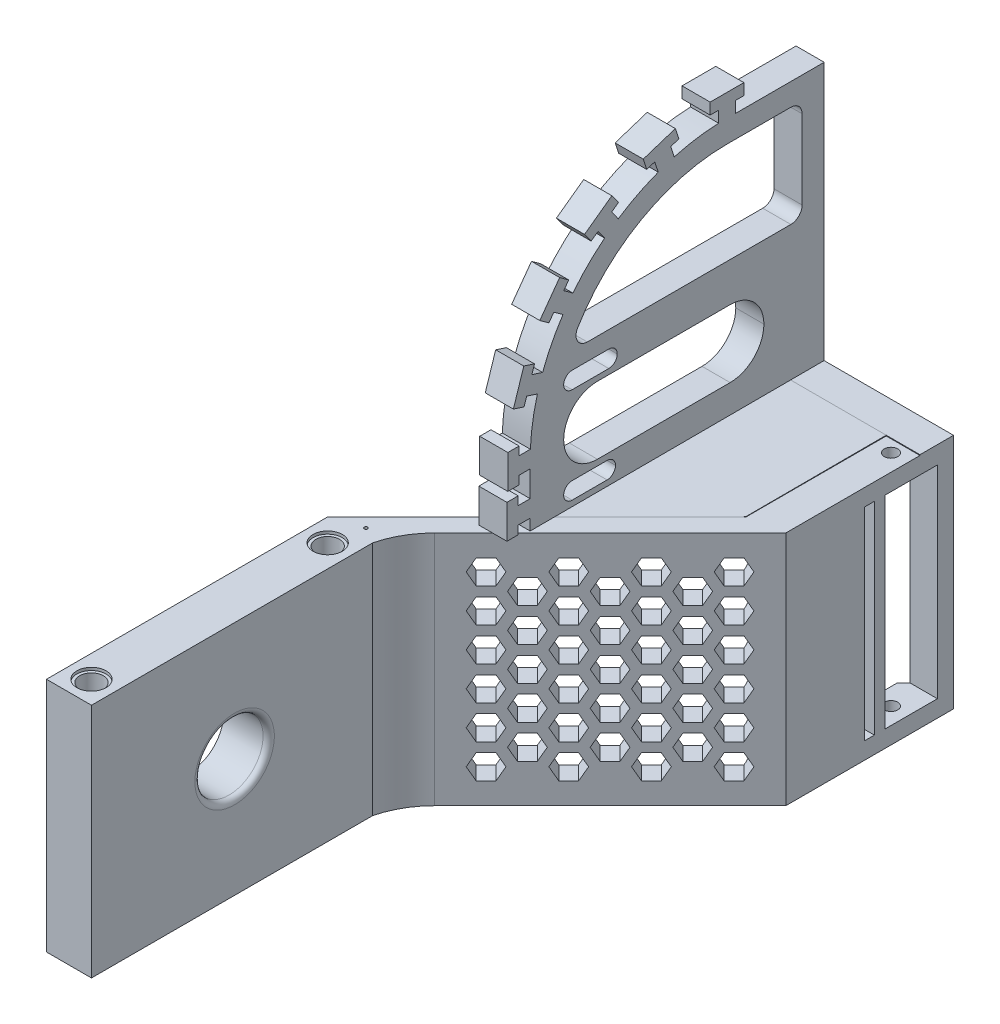
from build123d import *

# Parameters (mm, degrees)
SKETCH1_W                = 25
SKETCH1_H                = 50
SKETCH1_R                = 3.4
BOSS_EXTRUDE1_DEPTH      = 3
SKETCH2_W                = 50
SKETCH2_H                = 3
BOSS_EXTRUDE2_DEPTH      = 8
SKETCH3_W                = 8
SKETCH3_H                = 50
BOSS_EXTRUDE3_DEPTH      = 42
SKETCH4_R                = 2.65
CUT_EXTRUDE1_DEPTH       = 0.5
SKETCH5_R                = 6.062177826
CUT_EXTRUDE2_DEPTH       = 9
FILLET2_R                = 1
SKETCH6_R                = 12.6
BOSS_EXTRUDE4_DEPTH      = 2
FILLET4_R                = 1
SKETCH8_R                = 1.589780168
SKETCH8_R_2              = 1.777428262
CUT_EXTRUDE3_DEPTH       = 10
SKETCH9_W                = 49.021678163
SKETCH9_H                = 20.976854622
CUT_EXTRUDE4_DEPTH       = 68.79439129
SKETCH11_R               = 2.1
CUT_EXTRUDE5_DEPTH       = 59.480168703
SKETCH14_R               = 2.6
CUT_EXTRUDE6_DEPTH       = 0.5
BOSS_EXTRUDE5_DEPTH      = 42
FILLET5_R                = 15
BOSS_EXTRUDE6_DEPTH      = 42
BOSS_EXTRUDE7_DEPTH      = 2
BOSS_EXTRUDE7_DEPTH_BACK = 3
SKETCH17_W               = 55.081474993
SKETCH17_H               = 51.357900832
BOSS_EXTRUDE8_DEPTH      = 2
FILL_START               = -39.593416363
FILL_PATTERN1_DEPTH      = 4.479865946
SKETCH27_W               = 7.5
SKETCH27_H               = 36
CUT_EXTRUDE11_DEPTH      = 118.275157945
SKETCH28_R               = 1.2
CUT_EXTRUDE12_DEPTH      = 114.988906416
SKETCH29_W               = 6
SKETCH29_H               = 42
BOSS_EXTRUDE11_DEPTH     = 5.87
CHAMFER1_SIZE            = 4
SKETCH30_R               = 0.3
CUT_EXTRUDE13_DEPTH      = 120.102110599
SKETCH31_W               = 1.8
SKETCH31_H               = 36
CUT_EXTRUDE14_DEPTH      = 10
BOSS_EXTRUDE13_REACH     = 133.206
SKETCH33_W               = 28
SKETCH33_H               = 1.999994694
BOSS_EXTRUDE14_REACH     = 127.756
SKETCH34_W               = 5
SKETCH34_H               = 51.357900832
SKETCH35_W               = 43.798297797
SKETCH35_H               = 12
CUT_EXTRUDE15_DEPTH      = 5
SKETCH36_W               = 5
SKETCH36_H               = 12
BOSS_EXTRUDE15_DEPTH     = 8.2
FILLET6_R                = 6
SKETCH37_W               = 9.524150039
SKETCH37_H               = 3
SKETCH37_W_2             = 9.213307868
CUT_EXTRUDE16_DEPTH      = 7.4
FILLET7_R                = 1.5
SKETCH38_W               = 3
SKETCH38_H               = 36
CUT_EXTRUDE17_DEPTH      = 7.4
CUT_EXTRUDE19_DEPTH      = 10
CUT_EXTRUDE20_DEPTH      = 10
FILLET8_R                = 2


# Read off the part's stored shape, not the designer's step: Fill Pattern1
# Some blends are built 0.0001 mm under size
with BuildPart() as part:
    # Sketch1 → Boss-Extrude1 (new body)
    with BuildSketch(Plane(origin=(0, 0, 0), x_dir=(1, 0, 0), z_dir=(0, 1, 0))):
        with Locations((2.276951673, 11.384758364)):
            Rectangle(SKETCH1_W, SKETCH1_H)
        with Locations(Location((1.276951673, 11.384758364, 0), (0, 0, 270))):
            Circle(SKETCH1_R, mode=Mode.SUBTRACT)
    extrude(amount=BOSS_EXTRUDE1_DEPTH)

    # Sketch2 → Boss-Extrude2 (add)
    with BuildSketch(Plane.ZY.offset(10.223048327)):
        with Locations((-11.384758364, 1.5)):
            Rectangle(SKETCH2_W, SKETCH2_H)
    extrude(amount=BOSS_EXTRUDE2_DEPTH)

    # Sketch3 → Boss-Extrude3 (add)
    with BuildSketch(Plane.XZ):
        with Locations((-14.223048327, -11.384758364)):
            Rectangle(SKETCH3_W, SKETCH3_H)
    extrude(amount=BOSS_EXTRUDE3_DEPTH)

    # Sketch4 → Cut-Extrude1 (cut)
    with BuildSketch(Plane(origin=(0, 3, 0), x_dir=(1, 0, 0), z_dir=(0, 1, 0))):
        with Locations(Location((-14.223048327, 32.384758364, 0), (0, 0, 270))):
            Circle(SKETCH4_R)
        with Locations(Location((-14.223048327, -9.615241636, 0), (0, 0, 270))):
            Circle(SKETCH4_R)
    cut_extrude1 = extrude(amount=-CUT_EXTRUDE1_DEPTH, mode=Mode.SUBTRACT)

    # Mirror1: Cut-Extrude1 across plane
    add(cut_extrude1.mirror(Plane.ZX.offset(-19.5)), mode=Mode.SUBTRACT)

    # Sketch5 → Cut-Extrude2 (cut)
    with BuildSketch(Plane.ZY.offset(18.223048327)):
        with Locations((-11.836279124, -21)):
            Circle(SKETCH5_R)
    extrude(amount=-CUT_EXTRUDE2_DEPTH, mode=Mode.SUBTRACT)

    # Fillet2
    fillet2_edges = [part.edges().sort_by_distance(p)[0] for p in [
        (-10.223048327, -21, -17.89845695),
    ]]
    fillet(fillet2_edges, radius=FILLET2_R)

    # Mirror2: Cut-Extrude1 across plane
    add(cut_extrude1.mirror(Plane.ZY.offset(1.723048327)), mode=Mode.SUBTRACT)

    # Sketch6 → Boss-Extrude4 (add)
    with BuildSketch(Plane(origin=(0, 3, 0), x_dir=(1, 0, 0), z_dir=(0, 1, 0))):
        with BuildLine():
            Line((14.776951673, 5.825082115), (14.776951673, 16.944434614))
            ThreePointArc((14.776951673, 16.944434614), (-13.323048327, 11.384758364), (14.776951673, 5.825082115))
        make_face()
        with Locations(Location((1.276951673, 11.384758364, 0), (0, 0, 270))):
            Circle(SKETCH6_R, mode=Mode.SUBTRACT)
    extrude(amount=BOSS_EXTRUDE4_DEPTH)

    # Fillet4
    # the kernel refuses this fillet: 1 mm, written as the material it takes off along each edge
    with BuildSketch(Plane(origin=(14.776951673, 5, -3.325082115), x_dir=(0, -1, 0), z_dir=(0, 0, -1))) as fillet4_piece_1:
        with BuildLine():
            CenterArc((FILLET4_R, FILLET4_R), FILLET4_R, 180, 90)
            Line((0, FILLET4_R), (0, 0))
            Line((0, 0), (FILLET4_R, 0))
        make_face()
    extrude(amount=16.119352499, mode=Mode.SUBTRACT)

    # Sketch8 → Cut-Extrude3 (cut)
    with BuildSketch(Plane(origin=(0, 3, 0), x_dir=(1, 0, 0), z_dir=(0, 1, 0))):
        with Locations(Location((1.276951673, 19.884758364, 0), (0, 0, 270))):
            Circle(SKETCH8_R)
        with Locations(Location((1.276951673, 2.884758364, 0), (0, 0, 270))):
            Circle(SKETCH8_R_2)
    extrude(amount=-CUT_EXTRUDE3_DEPTH, mode=Mode.SUBTRACT)

    # Sketch9 → Cut-Extrude4 (cut, through all)
    with BuildSketch(Plane.XY.offset(13.615241636)):
        with Locations((-9.733887409, 10.488427311)):
            Rectangle(SKETCH9_W, SKETCH9_H)
    extrude(amount=-CUT_EXTRUDE4_DEPTH, mode=Mode.SUBTRACT)

    # Sketch11 → Cut-Extrude5 (cut, through all)
    with BuildSketch(Plane(origin=(0, 0, 0), x_dir=(1, 0, 0), z_dir=(0, 1, 0))):
        with Locations(Location((-14.223048327, 32.384758364, 0), (0, 0, 270))):
            Circle(SKETCH11_R)
    cut_extrude5 = extrude(amount=-CUT_EXTRUDE5_DEPTH, mode=Mode.SUBTRACT)

    # Mirror3: Cut-Extrude5 across plane
    add(cut_extrude5.mirror(Plane.XY.offset(-11.384758364)), mode=Mode.SUBTRACT)

    # Sketch14 → Cut-Extrude6 (cut)
    with BuildSketch(Plane(origin=(0, 0, 0), x_dir=(1, 0, 0), z_dir=(0, 1, 0))):
        with Locations(Location((-14.223048327, -9.615241636, 0), (0, 0, 270))):
            Circle(SKETCH14_R)
    cut_extrude6 = extrude(amount=-CUT_EXTRUDE6_DEPTH, mode=Mode.SUBTRACT)

    # Mirror4: Cut-Extrude6 across plane
    add(cut_extrude6.mirror(Plane.XY.offset(-11.384758364)), mode=Mode.SUBTRACT)

    # Sketch15 → Boss-Extrude5 (add)
    with BuildSketch(Plane(origin=(0, 0, 0), x_dir=(1, 0, 0), z_dir=(0, 1, 0))):
        Polygon((-18.223048327, 36.384758364), (24.976951673, 79.584758364), (24.976951673, 74.635010896), (-13.273300859, 36.384758364), align=None)
    extrude(amount=-BOSS_EXTRUDE5_DEPTH)

    # Fillet5
    # the kernel refuses this fillet: 15 mm, written as the material it adds along each edge
    with BuildSketch(Plane(origin=(-13.273300859, 0, -36.384758364), x_dir=(1, 0, 0), z_dir=(0, -1, 0))) as fillet5_piece_1:
        with BuildLine():
            CenterArc((17.611399837, 3.601803599), FILLET5_R, 193.893637127, 31.106362873)
            Line((7.004798119, -7.004798119), (0, 0))
            Line((0, 0), (3.050252532, 0))
        make_face()
    extrude(amount=42)

    # Sketch16 → Boss-Extrude6 (add)
    with BuildSketch(Plane(origin=(0, 0, 0), x_dir=(1, 0, 0), z_dir=(0, 1, 0))):
        Polygon((18.976951673, 73.584758364), (18.976951673, 98.584758364), (24.976951673, 98.584758364), (24.976951673, 79.584758364), align=None)
    extrude(amount=-BOSS_EXTRUDE6_DEPTH)



with BuildPart() as body_2:
    # Sketch17 → Boss-Extrude7 (new, two sides: drawn at the far end of the back side and taken through both)
    with BuildSketch(Plane(origin=(-0.023048327, -88.270826713, 236.630045038), x_dir=(0, 0.002303401717977271, -0.999997347166744), z_dir=(1, 0, 0)).offset(-BOSS_EXTRUDE7_DEPTH_BACK)):
        with Locations((307.762919346, 113.30454533)):
            Rectangle(SKETCH17_W, SKETCH17_H)
    extrude(amount=BOSS_EXTRUDE7_DEPTH + BOSS_EXTRUDE7_DEPTH_BACK)


with BuildPart() as part_1:
    add(part.part)

    add(body_2.part)  # Boss-Extrude8 merges body 2
    # Sketch18 → Boss-Extrude8 (add)
    with BuildSketch(Plane(origin=(0, -0.099943314, -0.00023021), x_dir=(1, 0, 0), z_dir=(0, -0.9999973471667442, -0.0023034017179773937))):
        Polygon((-3.023048327, -98.470916371), (-3.023048327, -51.487878646), (18.976951673, -73.487820284), (18.976951673, -98.487753963), (-3.023048327, -98.487753963), align=None)
    extrude(amount=BOSS_EXTRUDE8_DEPTH)

    # Fill Pattern1 outline → Fill Pattern1 (cut)
    with BuildSketch(Plane(origin=(0, 0, 0), x_dir=(0.7071067811865457, 0, -0.7071067811865495), z_dir=(0.7071067811865493, 0, 0.7071067811865458)).offset(FILL_START)):
        Polygon((30.253964255, -6), (31.503964255, -8.165063509), (34.003964255, -8.165063509), (35.253964255, -6), (34.003964255, -3.834936491), (31.503964255, -3.834936491), align=None)
        Polygon((45.842421523, -33), (47.092421523, -35.165063509), (49.592421523, -35.165063509), (50.842421523, -33), (49.592421523, -30.834936491), (47.092421523, -30.834936491), align=None)
        Polygon((40.6462691, -24), (41.8962691, -26.165063509), (44.3962691, -26.165063509), (45.6462691, -24), (44.3962691, -21.834936491), (41.8962691, -21.834936491), align=None)
        Polygon((35.450116678, -15), (36.700116678, -17.165063509), (39.200116678, -17.165063509), (40.450116678, -15), (39.200116678, -12.834936491), (36.700116678, -12.834936491), align=None)
        Polygon((52.288573946, -8.165063509), (54.788573946, -8.165063509), (56.038573946, -6), (54.788573946, -3.834936491), (52.288573946, -3.834936491), (51.038573946, -6), align=None)
        Polygon((41.8962691, -8.165063509), (44.3962691, -8.165063509), (45.6462691, -6), (44.3962691, -3.834936491), (41.8962691, -3.834936491), (40.6462691, -6), align=None)
        Polygon((62.680878791, -8.165063509), (65.180878791, -8.165063509), (66.430878791, -6), (65.180878791, -3.834936491), (62.680878791, -3.834936491), (61.430878791, -6), align=None)
        Polygon((30.253964255, -24), (31.503964255, -26.165063509), (34.003964255, -26.165063509), (35.253964255, -24), (34.003964255, -21.834936491), (31.503964255, -21.834936491), align=None)
        Polygon((35.450116678, -33), (36.700116678, -35.165063509), (39.200116678, -35.165063509), (40.450116678, -33), (39.200116678, -30.834936491), (36.700116678, -30.834936491), align=None)
        Polygon((62.680878791, -26.165063509), (65.180878791, -26.165063509), (66.430878791, -24), (65.180878791, -21.834936491), (62.680878791, -21.834936491), (61.430878791, -24), align=None)
        Polygon((52.288573946, -26.165063509), (54.788573946, -26.165063509), (56.038573946, -24), (54.788573946, -21.834936491), (52.288573946, -21.834936491), (51.038573946, -24), align=None)
        Polygon((57.484726369, -35.165063509), (59.984726369, -35.165063509), (61.234726369, -33), (59.984726369, -30.834936491), (57.484726369, -30.834936491), (56.234726369, -33), align=None)
        Polygon((49.592421523, -17.165063509), (50.842421523, -15), (49.592421523, -12.834936491), (47.092421523, -12.834936491), (45.842421523, -15), (47.092421523, -17.165063509), align=None)
        Polygon((35.450116678, -27), (36.700116678, -29.165063509), (39.200116678, -29.165063509), (40.450116678, -27), (39.200116678, -24.834936491), (36.700116678, -24.834936491), align=None)
        Polygon((30.253964255, -18), (31.503964255, -20.165063509), (34.003964255, -20.165063509), (35.253964255, -18), (34.003964255, -15.834936491), (31.503964255, -15.834936491), align=None)
        Polygon((40.6462691, -36), (41.8962691, -38.165063509), (44.3962691, -38.165063509), (45.6462691, -36), (44.3962691, -33.834936491), (41.8962691, -33.834936491), align=None)
        Polygon((57.484726369, -29.165063509), (59.984726369, -29.165063509), (61.234726369, -27), (59.984726369, -24.834936491), (57.484726369, -24.834936491), (56.234726369, -27), align=None)
        Polygon((47.092421523, -29.165063509), (49.592421523, -29.165063509), (50.842421523, -27), (49.592421523, -24.834936491), (47.092421523, -24.834936491), (45.842421523, -27), align=None)
        Polygon((34.003964255, -38.165063509), (35.253964255, -36), (34.003964255, -33.834936491), (31.503964255, -33.834936491), (30.253964255, -36), (31.503964255, -38.165063509), align=None)
        Polygon((49.592421523, -11.165063509), (50.842421523, -9), (49.592421523, -6.834936491), (47.092421523, -6.834936491), (45.842421523, -9), (47.092421523, -11.165063509), align=None)
        Polygon((44.3962691, -20.165063509), (45.6462691, -18), (44.3962691, -15.834936491), (41.8962691, -15.834936491), (40.6462691, -18), (41.8962691, -20.165063509), align=None)
        Polygon((35.450116678, -21), (36.700116678, -23.165063509), (39.200116678, -23.165063509), (40.450116678, -21), (39.200116678, -18.834936491), (36.700116678, -18.834936491), align=None)
        Polygon((30.253964255, -12), (31.503964255, -14.165063509), (34.003964255, -14.165063509), (35.253964255, -12), (34.003964255, -9.834936491), (31.503964255, -9.834936491), align=None)
        Polygon((40.6462691, -30), (41.8962691, -32.165063509), (44.3962691, -32.165063509), (45.6462691, -30), (44.3962691, -27.834936491), (41.8962691, -27.834936491), align=None)
        Polygon((57.484726369, -23.165063509), (59.984726369, -23.165063509), (61.234726369, -21), (59.984726369, -18.834936491), (57.484726369, -18.834936491), (56.234726369, -21), align=None)
        Polygon((47.092421523, -23.165063509), (49.592421523, -23.165063509), (50.842421523, -21), (49.592421523, -18.834936491), (47.092421523, -18.834936491), (45.842421523, -21), align=None)
        Polygon((34.003964255, -32.165063509), (35.253964255, -30), (34.003964255, -27.834936491), (31.503964255, -27.834936491), (30.253964255, -30), (31.503964255, -32.165063509), align=None)
        Polygon((44.3962691, -14.165063509), (45.6462691, -12), (44.3962691, -9.834936491), (41.8962691, -9.834936491), (40.6462691, -12), (41.8962691, -14.165063509), align=None)
        Polygon((62.680878791, -32.165063509), (65.180878791, -32.165063509), (66.430878791, -30), (65.180878791, -27.834936491), (62.680878791, -27.834936491), (61.430878791, -30), align=None)
        Polygon((52.288573946, -32.165063509), (54.788573946, -32.165063509), (56.038573946, -30), (54.788573946, -27.834936491), (52.288573946, -27.834936491), (51.038573946, -30), align=None)
        Polygon((62.680878791, -38.165063509), (65.180878791, -38.165063509), (66.430878791, -36), (65.180878791, -33.834936491), (62.680878791, -33.834936491), (61.430878791, -36), align=None)
        Polygon((52.288573946, -38.165063509), (54.788573946, -38.165063509), (56.038573946, -36), (54.788573946, -33.834936491), (52.288573946, -33.834936491), (51.038573946, -36), align=None)
        Polygon((56.234726369, -15), (57.484726369, -17.165063509), (59.984726369, -17.165063509), (61.234726369, -15), (59.984726369, -12.834936491), (57.484726369, -12.834936491), align=None)
        Polygon((56.234726369, -9), (57.484726369, -11.165063509), (59.984726369, -11.165063509), (61.234726369, -9), (59.984726369, -6.834936491), (57.484726369, -6.834936491), align=None)
        Polygon((61.430878791, -18), (62.680878791, -20.165063509), (65.180878791, -20.165063509), (66.430878791, -18), (65.180878791, -15.834936491), (62.680878791, -15.834936491), align=None)
        Polygon((36.700116678, -11.165063509), (39.200116678, -11.165063509), (40.450116678, -9), (39.200116678, -6.834936491), (36.700116678, -6.834936491), (35.450116678, -9), align=None)
        Polygon((54.788573946, -20.165063509), (56.038573946, -18), (54.788573946, -15.834936491), (52.288573946, -15.834936491), (51.038573946, -18), (52.288573946, -20.165063509), align=None)
        Polygon((62.680878791, -14.165063509), (65.180878791, -14.165063509), (66.430878791, -12), (65.180878791, -9.834936491), (62.680878791, -9.834936491), (61.430878791, -12), align=None)
        Polygon((52.288573946, -14.165063509), (54.788573946, -14.165063509), (56.038573946, -12), (54.788573946, -9.834936491), (52.288573946, -9.834936491), (51.038573946, -12), align=None)
    extrude(amount=FILL_PATTERN1_DEPTH, mode=Mode.SUBTRACT)

    # Sketch27 → Cut-Extrude11 (cut, through all)
    with BuildSketch(Plane.ZY.offset(-18.976951673)):
        with Locations((-97.834758364, -21)):
            Rectangle(SKETCH27_W, SKETCH27_H)
    extrude(amount=-CUT_EXTRUDE11_DEPTH, mode=Mode.SUBTRACT)

    # Sketch28 → Cut-Extrude12 (cut, through all)
    with BuildSketch(Plane(origin=(0, 0, 0), x_dir=(1, 0, 0), z_dir=(0, 1, 0))):
        with Locations(Location((21.976951673, 96.334758364, 0), (0, 0, 270))):
            Circle(SKETCH28_R)
    extrude(amount=-CUT_EXTRUDE12_DEPTH, mode=Mode.SUBTRACT)

    # Sketch29 → Boss-Extrude11 (add)
    with BuildSketch(Plane(origin=(0, 0, -98.584758364), x_dir=(-1, 0, 0), z_dir=(0, 0, -1))):
        with Locations((-21.976951673, -21)):
            Rectangle(SKETCH29_W, SKETCH29_H)
    extrude(amount=BOSS_EXTRUDE11_DEPTH)

    # Chamfer1
    chamfer1_edges = [part_1.edges().sort_by_distance(p)[0] for p in [
        (18.976951673, -21, -104.454758364),
    ]]
    chamfer(chamfer1_edges, length=CHAMFER1_SIZE)

    # Sketch30 → Cut-Extrude13 (cut, through all)
    with BuildSketch(Plane(origin=(0, 0, 0), x_dir=(1, 0, 0), z_dir=(0, 1, 0))):
        with Locations(Location((-13.114758504, 38.068023801, 0), (0, 0, 270))):
            Circle(SKETCH30_R)
    extrude(amount=-CUT_EXTRUDE13_DEPTH, mode=Mode.SUBTRACT)

    # Sketch31 → Cut-Extrude14 (cut)
    with BuildSketch(Plane(origin=(24.976951673, 0, 0), x_dir=(0, 0, -1), z_dir=(1, 0, 0))):
        with Locations((93.184758364, -21)):
            Rectangle(SKETCH31_W, SKETCH31_H)
        with Locations((89.484758364, -21)):
            Rectangle(SKETCH31_W, SKETCH31_H)
    extrude(amount=-CUT_EXTRUDE14_DEPTH, mode=Mode.SUBTRACT)

    # Boss-Extrude13: up to this plane
    boss_extrude13_end = Plane(origin=(18.976951673, -1.873081146, -98.492329705), z_dir=(0, -0.0023034017179773933, 0.999997347166744))
    # Sketch33 → Boss-Extrude13 (add, up to the surface)
    with BuildSketch(Plane(origin=(0, 0, -104.454758364), x_dir=(-1, 0, 0), z_dir=(0, 0, -1)), mode=Mode.PRIVATE) as boss_extrude13_sk1:
        with Locations((-10.976951673, -0.873083799)):
            Rectangle(SKETCH33_W, SKETCH33_H)
    boss_extrude13_tool1 = split(extrude(boss_extrude13_sk1.sketch, amount=-BOSS_EXTRUDE13_REACH, mode=Mode.PRIVATE), bisect_by=boss_extrude13_end, keep=Keep.BOTH, mode=Mode.PRIVATE)
    add(boss_extrude13_tool1.solids().sort_by_distance((10.976952, -0.873084, -104.454758))[0])

    # Boss-Extrude14: up to this plane
    boss_extrude14_end = Plane(origin=(0, 0, -104.454758364), z_dir=(0, 0, -1))
    # Sketch34 → Boss-Extrude14 (add, up to the surface)
    with BuildSketch(Plane(origin=(0, 0.226818078, -98.470655144), x_dir=(-1, 0, 0), z_dir=(0, 0.0023034017179766083, -0.9999973471667442)), mode=Mode.PRIVATE) as boss_extrude14_sk1:
        with Locations((0.523048327, 25.579006837)):
            Rectangle(SKETCH34_W, SKETCH34_H)
    boss_extrude14_tool1 = split(extrude(boss_extrude14_sk1.sketch, amount=BOSS_EXTRUDE14_REACH, mode=Mode.PRIVATE), bisect_by=boss_extrude14_end, keep=Keep.BOTH, mode=Mode.PRIVATE)
    add(boss_extrude14_tool1.solids().sort_by_distance((-0.523048, 25.805757, -98.411736))[0])

    # Sketch35 → Cut-Extrude15 (cut)
    with BuildSketch(Plane(origin=(1.976951673, 0, 0), x_dir=(0, 0, -1), z_dir=(1, 0, 0))):
        with Locations((80.040234019, 11.100907392)):
            Rectangle(SKETCH35_W, SKETCH35_H)
    extrude(amount=-CUT_EXTRUDE15_DEPTH, mode=Mode.SUBTRACT)

    # Sketch36 → Boss-Extrude15 (add)
    with BuildSketch(Plane.XY.offset(-101.939382917)):
        with Locations((-0.523048327, 11.100907392)):
            Rectangle(SKETCH36_W, SKETCH36_H)
    extrude(amount=BOSS_EXTRUDE15_DEPTH)

    # Fillet6
    fillet6_edges = [part_1.edges().sort_by_distance(p)[0] for p in [
        (-0.523048327, 17.100907392, -58.14108512),
        (-0.523048327, 5.100907392, -58.14108512),
        (-0.523048327, 5.100907392, -93.739382917),
        (-0.523048327, 17.100907392, -93.739382917),
    ]]
    fillet(fillet6_edges, radius=FILLET6_R - 0.0001)  # a hair under: the kernel refuses the full size

    # Sketch37 → Cut-Extrude16 (cut)
    with BuildSketch(Plane(origin=(1.976951673, 0, 0), x_dir=(0, 0, -1), z_dir=(1, 0, 0))):
        with Locations((62.90316014, 19.552513407)):
            Rectangle(SKETCH37_W, SKETCH37_H)
        with Locations((62.747739054, 2.552558505)):
            Rectangle(SKETCH37_W_2, SKETCH37_H)
    extrude(amount=-CUT_EXTRUDE16_DEPTH, mode=Mode.SUBTRACT)

    # Fillet7
    fillet7_edges = [part_1.edges().sort_by_distance(p)[0] for p in [
        (-0.523048327, 18.052513407, -58.14108512),
        (-0.523048327, 1.052558505, -58.14108512),
        (-0.523048327, 4.052558505, -58.14108512),
        (-0.523048327, 21.052513407, -58.14108512),
        (-0.523048327, 18.052513407, -67.665235159),
        (-0.523048327, 4.052558505, -67.354392988),
        (-0.523048327, 21.052513407, -67.665235159),
        (-0.523048327, 1.052558505, -67.354392988),
    ]]
    fillet(fillet7_edges, radius=FILLET7_R - 0.0001)  # a hair under: the kernel refuses the full size

    # Sketch38 → Cut-Extrude17 (cut)
    with BuildSketch(Plane(origin=(24.976951673, 0, 0), x_dir=(0, 0, -1), z_dir=(1, 0, 0))):
        with Locations((100.084758364, -21)):
            Rectangle(SKETCH38_W, SKETCH38_H)
    extrude(amount=-CUT_EXTRUDE17_DEPTH, mode=Mode.SUBTRACT)

    # Sketch41 → Cut-Extrude19 (cut)
    with BuildSketch(Plane(origin=(1.976951673, 0, 0), x_dir=(0, 0, -1), z_dir=(1, 0, 0))):
        with BuildLine():
            Line((50.054130992, 5.00608367), (52.184758364, 5.00608367))
            Line((52.184758364, 5.00608367), (52.184758364, 9.600907392))
            Line((52.184758364, 9.600907392), (50.216915995, 9.600907392))
            Line((50.216915995, 9.600907392), (50.216915995, 8.100907392))
            Line((50.216915995, 8.100907392), (48.216915995, 8.100907392))
            Line((48.216915995, 8.100907392), (48.216915995, 14.100907392))
            Line((48.216915995, 14.100907392), (50.216915995, 14.100907392))
            Line((50.216915995, 14.100907392), (50.216915995, 12.600907392))
            Line((50.216915995, 12.600907392), (52.216915995, 12.600907392))
            ThreePointArc((52.216915995, 12.600907392), (52.615666443, 16.576113669), (53.464838526, 20.479980167))
            Line((53.464838526, 20.479980167), (51.562725494, 21.098014155))
            Line((51.562725494, 21.098014155), (51.099200002, 19.671429381))
            Line((51.099200002, 19.671429381), (49.197086969, 20.28946337))
            Line((49.197086969, 20.28946337), (51.051188936, 25.995802467))
            Line((51.051188936, 25.995802467), (52.953301968, 25.377768479))
            Line((52.953301968, 25.377768479), (52.489776477, 23.951183704))
            Line((52.489776477, 23.951183704), (54.391889509, 23.333149715))
            ThreePointArc((54.391889509, 23.333149715), (55.999530018, 26.990574883), (58.013501752, 30.44096395))
            Line((58.013501752, 30.44096395), (56.395467763, 31.616534455))
            Line((56.395467763, 31.616534455), (55.513789885, 30.403008963))
            Line((55.513789885, 30.403008963), (53.895755896, 31.578579468))
            Line((53.895755896, 31.578579468), (57.42246741, 36.432681434))
            Line((57.42246741, 36.432681434), (59.040501399, 35.257110929))
            Line((59.040501399, 35.257110929), (58.15882352, 34.043585438))
            Line((58.15882352, 34.043585438), (59.776857509, 32.868014933))
            ThreePointArc((59.776857509, 32.868014933), (62.436021023, 35.849644734), (65.417650823, 38.508808247))
            Line((65.417650823, 38.508808247), (64.242080319, 40.126842236))
            Line((64.242080319, 40.126842236), (63.028554827, 39.245164358))
            Line((63.028554827, 39.245164358), (61.852984323, 40.863198347))
            Line((61.852984323, 40.863198347), (66.707086289, 44.38990986))
            Line((66.707086289, 44.38990986), (67.882656793, 42.771875872))
            Line((67.882656793, 42.771875872), (66.669131302, 41.890197993))
            Line((66.669131302, 41.890197993), (67.844701806, 40.272164004))
            ThreePointArc((67.844701806, 40.272164004), (71.295090873, 42.286135739), (74.952516041, 43.893776247))
            Line((74.952516041, 43.893776247), (74.334482052, 45.79588928))
            Line((74.334482052, 45.79588928), (72.907897278, 45.332363788))
            Line((72.907897278, 45.332363788), (72.289863289, 47.234476821))
            Line((72.289863289, 47.234476821), (77.996202387, 49.088578787))
            Line((77.996202387, 49.088578787), (78.614236376, 47.186465754))
            Line((78.614236376, 47.186465754), (77.187651601, 46.722940263))
            Line((77.187651601, 46.722940263), (77.80568559, 44.82082723))
            ThreePointArc((77.80568559, 44.82082723), (81.709552088, 45.669999313), (85.684758364, 46.068749762))
            Line((85.684758364, 46.068749762), (85.684758364, 48.068749762))
            Line((85.684758364, 48.068749762), (84.184758364, 48.068749762))
            Line((84.184758364, 48.068749762), (84.184758364, 50.068749762))
            Line((84.184758364, 50.068749762), (90.184758364, 50.068749762))
            Line((90.184758364, 50.068749762), (90.184758364, 48.068749762))
            Line((90.184758364, 48.068749762), (88.684758364, 48.068749762))
            Line((88.684758364, 48.068749762), (88.684758364, 46.068749762))
            Line((88.684758364, 46.068749762), (104.454758364, 46.068749762))
            Line((104.454758364, 46.068749762), (104.454758364, 51.498695141))
            Line((104.454758364, 51.498695141), (43.271258606, 51.357764588))
            Line((43.271258606, 51.357764588), (43.389556483, 0))
            Line((43.389556483, 0), (52.184758364, 0.020258937))
            Line((52.184758364, 0.020258937), (52.184758364, 2.00608367))
            Line((52.184758364, 2.00608367), (50.054130992, 2.00608367))
            Line((50.054130992, 2.00608367), (50.054130992, 0.50608367))
            Line((50.054130992, 0.50608367), (48.054130992, 0.50608367))
            Line((48.054130992, 0.50608367), (48.054130992, 6.50608367))
            Line((48.054130992, 6.50608367), (50.054130992, 6.50608367))
            Line((50.054130992, 6.50608367), (50.054130992, 5.00608367))
        make_face()
    extrude(amount=-CUT_EXTRUDE19_DEPTH, mode=Mode.SUBTRACT)

    # Sketch42 → Cut-Extrude20 (cut)
    with BuildSketch(Plane(origin=(1.976951673, 0, 0), x_dir=(0, 0, -1), z_dir=(1, 0, 0))):
        with BuildLine():
            ThreePointArc((59.019959383, 24.052513407), (70.459026489, 37.201671619), (87.184758364, 42.100907392))
            Line((87.184758364, 42.100907392), (100.530698806, 42.100907392))
            Line((100.530698806, 42.100907392), (100.530698806, 24.052513407))
            Line((100.530698806, 24.052513407), (67.858238291, 24.052513407))
            Line((67.858238291, 24.052513407), (59.019959383, 24.052513407))
        make_face()
    extrude(amount=-CUT_EXTRUDE20_DEPTH, mode=Mode.SUBTRACT)

    # Fillet8
    fillet8_edges = [part_1.edges().sort_by_distance(p)[0] for p in [
        (-0.523048327, 24.052513407, -59.019959383),
        (-0.523048327, 42.100907392, -100.530698806),
        (-0.523048327, 24.052513407, -100.530698806),
    ]]
    fillet(fillet8_edges, radius=FILLET8_R)


solid = part_1.part
